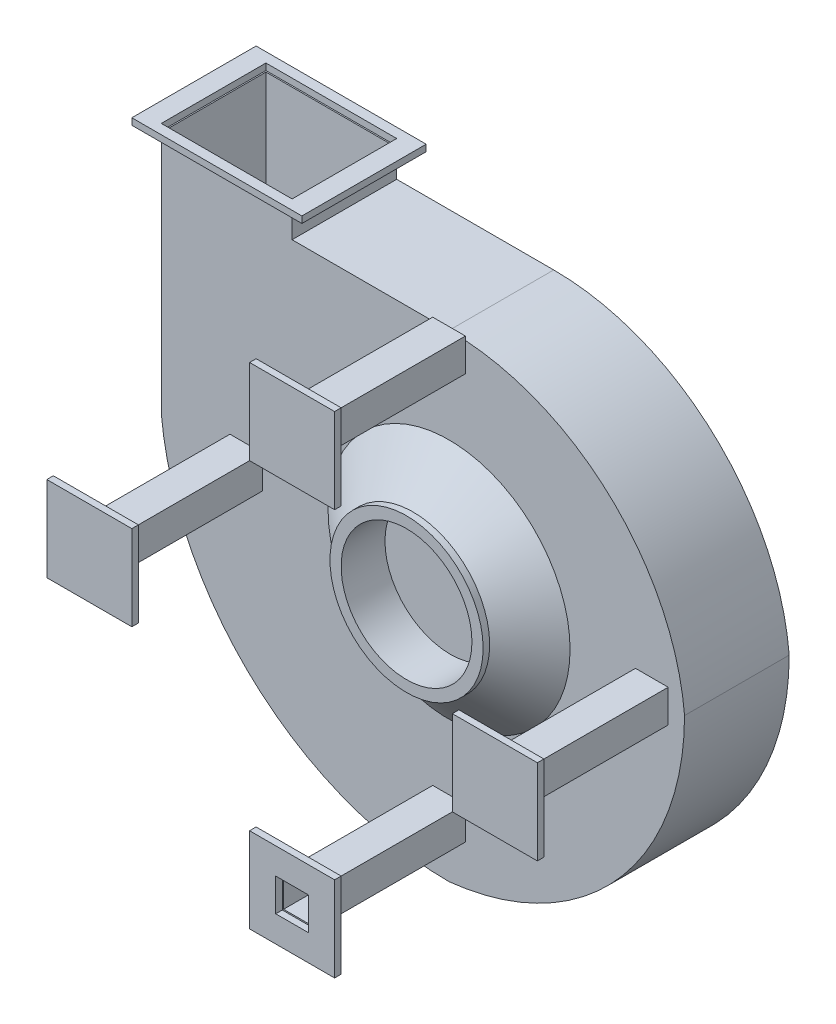
from build123d import *

# Parameters (mm, degrees)
BOSS_EXTRUDE1_DEPTH       = 160
SHELL1_START              = 2
SHELL1_DEPTH              = 156
SKETCH4_R                 = 90
CUT_EXTRUDE1_DEPTH        = 54
SKETCH5_R                 = 185
BOSS_EXTRUDE2_DEPTH       = 55
BOSS_EXTRUDE2_TAPER       = 51
SKETCH6_R                 = 117.080656391
BOSS_EXTRUDE3_DEPTH       = 10
SKETCH7_R                 = 100
CUT_EXTRUDE2_DEPTH        = 117
SKETCH8_R                 = 10
CUT_EXTRUDE3_DEPTH        = 117
SKETCH11_W                = 260
SKETCH11_H                = 190
SKETCH11_W_2              = 200
SKETCH11_H_2              = 160
BOSS_EXTRUDE5_DEPTH       = 10
EXTRUDE_THIN1_OUTLINE_W   = 50
EXTRUDE_THIN1_OUTLINE_H   = 50
EXTRUDE_THIN1_OUTLINE_W_2 = 46
EXTRUDE_THIN1_OUTLINE_H_2 = 46
EXTRUDE_THIN1_DEPTH       = 230
SKETCH16_W                = 130
SKETCH16_H                = 130
BOSS_EXTRUDE6_DEPTH       = 10
SKETCH16_W_2              = 50
SKETCH16_H_2              = 50
BOSS_EXTRUDE6_2_DEPTH     = 10
BOSS_EXTRUDE6_3_DEPTH     = 10
BOSS_EXTRUDE6_4_DEPTH     = 10


# Read off the part's stored shape, not the designer's step: Shell1, Extrude-Thin1
with BuildPart() as part:
    # Sketch2 → Boss-Extrude1 (new body)
    with BuildSketch(Plane.XY):
        with BuildLine():
            Line((-178.596901506, -100.099781817), (-178.596901506, 273.900218183))
            Line((-178.596901506, 273.900218183), (21.403098494, 273.900218183))
            Line((21.403098494, 273.900218183), (21.403098494, 229.900218183))
            Line((21.403098494, 229.900218183), (261.403098494, 229.900218183))
            ThreePointArc((261.403098494, 229.900218183), (505.585407435, 134.917282483), (621.403098494, -100.099781817))
            ThreePointArc((621.403098494, -100.099781817), (518.15029954, -369.172262759), (261.403098494, -500.099781817))
            ThreePointArc((261.403098494, -500.099781817), (-35.918276453, -385.153294258), (-178.596901506, -100.099781817))
        make_face()
    extrude(amount=BOSS_EXTRUDE1_DEPTH)

    # Shell1 outline → Shell1 (cut)
    with BuildSketch(Plane.XY.offset(SHELL1_START)):
        with BuildLine():
            ThreePointArc((-176.596901506, -100.004435497), (-34.576684312, -383.670001847), (261.297822808, -498.099769223))
            ThreePointArc((261.297822808, -498.099769223), (516.669826437, -367.827538484), (619.403089044, -100.18675106))
            ThreePointArc((619.403089044, -100.18675106), (504.20191059, 133.472347591), (261.403098494, 227.900218183))
            Line((261.403098494, 227.900218183), (19.403098494, 227.900218183))
            Line((19.403098494, 227.900218183), (19.403098494, 273.900218183))
            Line((19.403098494, 273.900218183), (-176.596901506, 273.900218183))
            Line((-176.596901506, 273.900218183), (-176.596901506, -100.004435497))
        make_face()
    extrude(amount=SHELL1_DEPTH, mode=Mode.SUBTRACT)

    # Sketch4 → Cut-Extrude1 (cut)
    with BuildSketch(Plane.XY.offset(160)):
        with Locations((261.403098494, -100.099781817)):
            Circle(SKETCH4_R)
    extrude(amount=-CUT_EXTRUDE1_DEPTH, mode=Mode.SUBTRACT)

    # Sketch5 → Boss-Extrude2 (add)
    with BuildSketch(Plane.XY.offset(160)):
        with Locations((261.403098494, -100.099781817)):
            Circle(SKETCH5_R)
    extrude(amount=BOSS_EXTRUDE2_DEPTH, taper=BOSS_EXTRUDE2_TAPER)

    # Sketch6 → Boss-Extrude3 (add)
    with BuildSketch(Plane.XY.offset(215)):
        with Locations((261.403098494, -100.099781817)):
            Circle(SKETCH6_R)
    extrude(amount=BOSS_EXTRUDE3_DEPTH)

    # Sketch7 → Cut-Extrude2 (cut)
    with BuildSketch(Plane.XY.offset(225)):
        with Locations((261.403098494, -100.099781817)):
            Circle(SKETCH7_R)
    extrude(amount=-CUT_EXTRUDE2_DEPTH, mode=Mode.SUBTRACT)

    # Sketch8 → Cut-Extrude3 (cut)
    with BuildSketch(Plane(origin=(0, 0, 0), x_dir=(-1, 0, 0), z_dir=(0, 0, -1))):
        with Locations((-262.623327997, -100.099781817)):
            Circle(SKETCH8_R)
    extrude(amount=-CUT_EXTRUDE3_DEPTH, mode=Mode.SUBTRACT)

    # Extrude-Thin1 outline → Extrude-Thin1 (add)
    # profile 1 of 4: a face of its own
    with BuildSketch(Plane.XY.offset(160)):
        with Locations((-48.596901506, -100.099781817)):
            Rectangle(EXTRUDE_THIN1_OUTLINE_W, EXTRUDE_THIN1_OUTLINE_H)
        with Locations((-48.596901506, -100.099781817)):
            Rectangle(EXTRUDE_THIN1_OUTLINE_W_2, EXTRUDE_THIN1_OUTLINE_H_2, mode=Mode.SUBTRACT)
    # profile 2 of 4: a face of its own
    with BuildSketch(Plane.XY.offset(160)):
        with Locations((571.403098494, -100.099781817)):
            Rectangle(EXTRUDE_THIN1_OUTLINE_W, EXTRUDE_THIN1_OUTLINE_H)
        with Locations((571.403098494, -100.099781817)):
            Rectangle(EXTRUDE_THIN1_OUTLINE_W_2, EXTRUDE_THIN1_OUTLINE_H_2, mode=Mode.SUBTRACT)
    # profile 3 of 4: a face of its own
    with BuildSketch(Plane.XY.offset(160)):
        with Locations((261.403098494, 209.900218183)):
            Rectangle(EXTRUDE_THIN1_OUTLINE_W, EXTRUDE_THIN1_OUTLINE_H)
        with Locations((261.403098494, 209.900218183)):
            Rectangle(EXTRUDE_THIN1_OUTLINE_W_2, EXTRUDE_THIN1_OUTLINE_H_2, mode=Mode.SUBTRACT)
    # profile 4 of 4: a face of its own
    with BuildSketch(Plane.XY.offset(160)):
        with Locations((261.403098494, -410.099781817)):
            Rectangle(EXTRUDE_THIN1_OUTLINE_W, EXTRUDE_THIN1_OUTLINE_H)
        with Locations((261.403098494, -410.099781817)):
            Rectangle(EXTRUDE_THIN1_OUTLINE_W_2, EXTRUDE_THIN1_OUTLINE_H_2, mode=Mode.SUBTRACT)
    extrude(amount=EXTRUDE_THIN1_DEPTH)


with BuildPart() as body_2:
    # Sketch11 → Boss-Extrude5 (new body)
    with BuildSketch(Plane(origin=(0, 273.900218183, 0), x_dir=(1, 0, 0), z_dir=(0, 1, 0))):
        with Locations((-78.596901506, -80)):
            Rectangle(SKETCH11_W, SKETCH11_H)
        with Locations((-78.596901506, -80)):
            Rectangle(SKETCH11_W_2, SKETCH11_H_2, mode=Mode.SUBTRACT)
    extrude(amount=BOSS_EXTRUDE5_DEPTH)


with BuildPart() as body_3:
    # Sketch16 → Boss-Extrude6 (new body)
    with BuildSketch(Plane.XY.offset(390)):
        with Locations((-48.596901506, -100.099781817)):
            Rectangle(SKETCH16_W, SKETCH16_H)
    extrude(amount=BOSS_EXTRUDE6_DEPTH)


with BuildPart() as body_4:
    # Sketch16 → Boss-Extrude6 2 (new body)
    with BuildSketch(Plane.XY.offset(390)):
        with Locations((261.403098494, -410.099781817)):
            Rectangle(SKETCH16_W, SKETCH16_H)
        with Locations((261.403098494, -410.099781817)):
            Rectangle(SKETCH16_W_2, SKETCH16_H_2, mode=Mode.SUBTRACT)
    extrude(amount=BOSS_EXTRUDE6_2_DEPTH)


with BuildPart() as body_5:
    # Sketch16 → Boss-Extrude6 3 (new body)
    with BuildSketch(Plane.XY.offset(390)):
        with Locations((261.403098494, 209.900218183)):
            Rectangle(SKETCH16_W, SKETCH16_H)
    extrude(amount=BOSS_EXTRUDE6_3_DEPTH)


with BuildPart() as body_6:
    # Sketch16 → Boss-Extrude6 4 (new body)
    with BuildSketch(Plane.XY.offset(390)):
        with Locations((571.403098494, -100.099781817)):
            Rectangle(SKETCH16_W, SKETCH16_H)
    extrude(amount=BOSS_EXTRUDE6_4_DEPTH)


solid = Compound([part.part, body_2.part, body_3.part, body_4.part, body_5.part, body_6.part])
